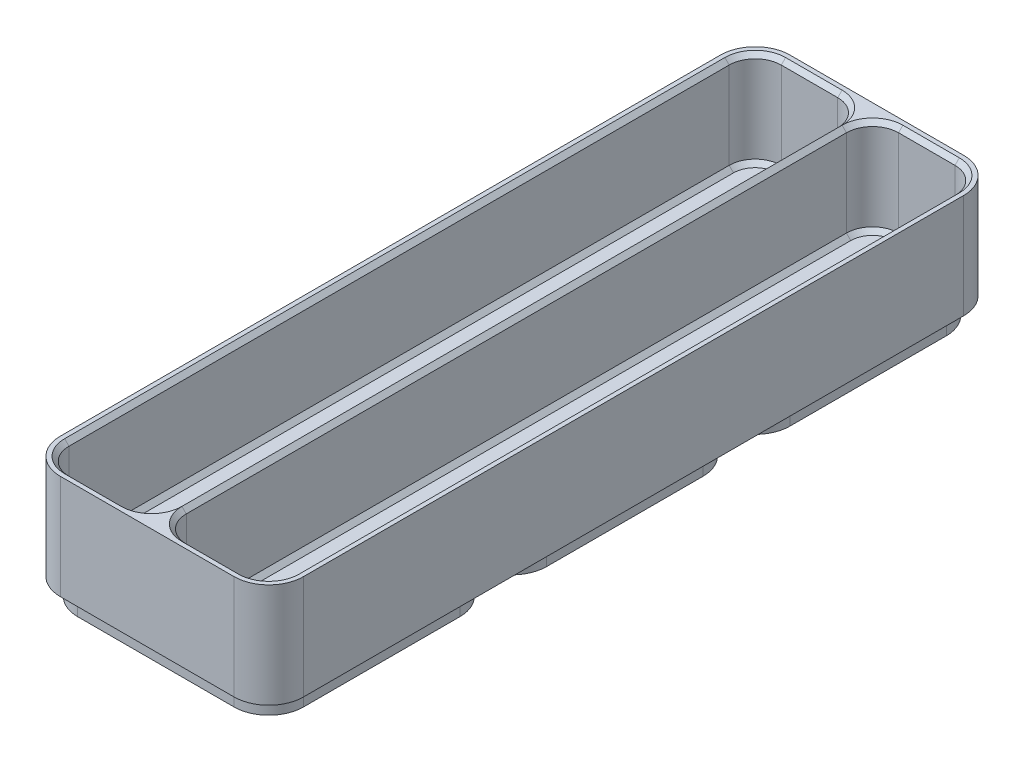
from build123d import *

# Parameters (mm, degrees)
BOSS_EXTRUDE4_DEPTH = 5
SKETCH7_R           = 3
CUT_EXTRUDE4_DEPTH  = 2
SKETCH8_W           = 70
SKETCH8_H           = 70
BOSS_EXTRUDE5_DEPTH = 30
MIRROR2_START       = 5
MIRROR2_OUTLINE_W   = 70
MIRROR2_OUTLINE_H   = 70
MIRROR2_DEPTH       = 30
MIRROR2_2_OUTLINE_R = 3
MIRROR2_2_DEPTH     = 5
MIRROR2_START_2     = 2
MIRROR2_3_OUTLINE_R = 3
MIRROR2_3_DEPTH     = 3
FILLET1_R           = 10
CUT_EXTRUDE5_DEPTH  = 30
BOSS_EXTRUDE6_DEPTH = 2.5
BOSS_EXTRUDE7_DEPTH = 27.5
FILLET2_R           = 7.5
CHAMFER1_SIZE       = 1.25


# Read off the part's stored shape, not the designer's step: Mirror2
with BuildPart() as part:
    # Sketch5 → Boss-Extrude4 (new body)
    with BuildSketch(Plane(origin=(0, 0, 0), x_dir=(1, 0, 0), z_dir=(0, 1, 0))):
        with BuildLine():
            Line((-22.5, -32.5), (22.5, -32.5))
            ThreePointArc((22.5, -32.5), (29.571067812, -29.571067812), (32.5, -22.5))
            Line((32.5, -22.5), (32.5, 22.5))
            ThreePointArc((32.5, 22.5), (29.571067812, 29.571067812), (22.5, 32.5))
            Line((22.5, 32.5), (-22.5, 32.5))
            ThreePointArc((-22.5, 32.5), (-29.571067812, 29.571067812), (-32.5, 22.5))
            Line((-32.5, 22.5), (-32.5, -22.5))
            ThreePointArc((-32.5, -22.5), (-29.571067812, -29.571067812), (-22.5, -32.5))
        make_face()
    extrude(amount=BOSS_EXTRUDE4_DEPTH)

    # Sketch7 → Cut-Extrude4 (cut)
    with BuildSketch(Plane.XZ):
        with Locations(Location((-26.035533906, 26.035533906, 0), (0, 0, 270))):
            Circle(SKETCH7_R)
        with Locations(Location((26.036533906, 26.036533906, 0), (0, 0, 270))):
            Circle(SKETCH7_R)
        with Locations(Location((26.037533906, -26.035533906, 0), (0, 0, 270))):
            Circle(SKETCH7_R)
        with Locations(Location((-26.034533906, -26.036533906, 0), (0, 0, 270))):
            Circle(SKETCH7_R)
    extrude(amount=-CUT_EXTRUDE4_DEPTH, mode=Mode.SUBTRACT)

    # Sketch8 → Boss-Extrude5 (add)
    with BuildSketch(Plane(origin=(0, 5, 0), x_dir=(1, 0, 0), z_dir=(0, 1, 0))):
        Rectangle(SKETCH8_W, SKETCH8_H)
    extrude(amount=BOSS_EXTRUDE5_DEPTH)

    # Mirror2 outline → Mirror2 (add)
    with BuildSketch(Plane(origin=(0, 0, 0), x_dir=(1, 0, 0), z_dir=(0, 1, 0)).offset(MIRROR2_START)):
        with Locations((0, -70)):
            Rectangle(MIRROR2_OUTLINE_W, MIRROR2_OUTLINE_H)
        with Locations((0, 70)):
            Rectangle(MIRROR2_OUTLINE_W, MIRROR2_OUTLINE_H)
    extrude(amount=MIRROR2_DEPTH)

    # Mirror2 2 outline → Mirror2 2 (add)
    # profile 1 of 2: a face of its own
    with BuildSketch(Plane(origin=(0, 0, 0), x_dir=(1, 0, 0), z_dir=(0, 1, 0))):
        with BuildLine():
            Line((32.5, -92.5), (32.5, -47.5))
            ThreePointArc((32.5, -47.5), (29.571067812, -40.428932188), (22.5, -37.5))
            Line((22.5, -37.5), (-22.5, -37.5))
            ThreePointArc((-22.5, -37.5), (-29.571067812, -40.428932188), (-32.5, -47.5))
            Line((-32.5, -47.5), (-32.5, -92.5))
            ThreePointArc((-32.5, -92.5), (-29.571067812, -99.571067812), (-22.5, -102.5))
            Line((-22.5, -102.5), (22.5, -102.5))
            ThreePointArc((22.5, -102.5), (29.571067812, -99.571067812), (32.5, -92.5))
        make_face()
        with Locations((-26.034533906, -96.036533906)):
            Circle(MIRROR2_2_OUTLINE_R, mode=Mode.SUBTRACT)
        with Locations((-26.035533906, -43.964466094)):
            Circle(MIRROR2_2_OUTLINE_R, mode=Mode.SUBTRACT)
        with Locations((26.037533906, -96.035533906)):
            Circle(MIRROR2_2_OUTLINE_R, mode=Mode.SUBTRACT)
        with Locations((26.036533906, -43.963466094)):
            Circle(MIRROR2_2_OUTLINE_R, mode=Mode.SUBTRACT)
    # profile 2 of 2: a face of its own
    with BuildSketch(Plane(origin=(0, 0, 0), x_dir=(1, 0, 0), z_dir=(0, 1, 0))):
        with BuildLine():
            Line((32.5, 47.5), (32.5, 92.5))
            ThreePointArc((32.5, 92.5), (29.571067812, 99.571067812), (22.5, 102.5))
            Line((22.5, 102.5), (-22.5, 102.5))
            ThreePointArc((-22.5, 102.5), (-29.571067812, 99.571067812), (-32.5, 92.5))
            Line((-32.5, 92.5), (-32.5, 47.5))
            ThreePointArc((-32.5, 47.5), (-29.571067812, 40.428932188), (-22.5, 37.5))
            Line((-22.5, 37.5), (22.5, 37.5))
            ThreePointArc((22.5, 37.5), (29.571067812, 40.428932188), (32.5, 47.5))
        make_face()
        with Locations((-26.034533906, 43.963466094)):
            Circle(MIRROR2_2_OUTLINE_R, mode=Mode.SUBTRACT)
        with Locations((-26.035533906, 96.035533906)):
            Circle(MIRROR2_2_OUTLINE_R, mode=Mode.SUBTRACT)
        with Locations((26.037533906, 43.964466094)):
            Circle(MIRROR2_2_OUTLINE_R, mode=Mode.SUBTRACT)
        with Locations((26.036533906, 96.036533906)):
            Circle(MIRROR2_2_OUTLINE_R, mode=Mode.SUBTRACT)
    extrude(amount=MIRROR2_2_DEPTH)

    # Mirror2 3 outline → Mirror2 3 (add)
    with BuildSketch(Plane(origin=(0, 0, 0), x_dir=(1, 0, 0), z_dir=(0, 1, 0)).offset(MIRROR2_START_2)):
        with Locations((-26.035533906, -43.964466094)):
            Circle(MIRROR2_3_OUTLINE_R)
        with Locations((26.036533906, -43.963466094)):
            Circle(MIRROR2_3_OUTLINE_R)
        with Locations((26.037533906, -96.035533906)):
            Circle(MIRROR2_3_OUTLINE_R)
        with Locations((-26.034533906, -96.036533906)):
            Circle(MIRROR2_3_OUTLINE_R)
        with Locations((-26.035533906, 96.035533906)):
            Circle(MIRROR2_3_OUTLINE_R)
        with Locations((26.036533906, 96.036533906)):
            Circle(MIRROR2_3_OUTLINE_R)
        with Locations((26.037533906, 43.964466094)):
            Circle(MIRROR2_3_OUTLINE_R)
        with Locations((-26.034533906, 43.963466094)):
            Circle(MIRROR2_3_OUTLINE_R)
    extrude(amount=MIRROR2_3_DEPTH)

    # Fillet1
    fillet1_edges = [part.edges().sort_by_distance(p)[0] for p in [
        (35, 20, 105),
        (-35, 20, 105),
        (-35, 20, -105),
        (35, 20, -105),
    ]]
    fillet(fillet1_edges, radius=FILLET1_R)

    # Sketch9 → Cut-Extrude5 (cut)
    with BuildSketch(Plane(origin=(0, 35, 0), x_dir=(1, 0, 0), z_dir=(0, 1, 0))):
        with BuildLine():
            Line((-32.5, 95), (-32.5, -95))
            ThreePointArc((-32.5, -95), (-30.303300859, -100.303300859), (-25, -102.5))
            Line((-25, -102.5), (25, -102.5))
            ThreePointArc((25, -102.5), (30.303300859, -100.303300859), (32.5, -95))
            Line((32.5, -95), (32.5, 95))
            ThreePointArc((32.5, 95), (30.303300859, 100.303300859), (25, 102.5))
            Line((25, 102.5), (-25, 102.5))
            ThreePointArc((-25, 102.5), (-30.303300859, 100.303300859), (-32.5, 95))
        make_face()
    extrude(amount=-CUT_EXTRUDE5_DEPTH, mode=Mode.SUBTRACT)


with BuildPart() as cut_extrude5_piece_1:
    # of the separate pieces the step leaves, piece 1, a body of its own (cut_extrude5_pieces)
    add(part.part.solids().sort_by_distance((35, 5, 95))[0])



with BuildPart() as cut_extrude5_piece_2:
    # of the separate pieces the step leaves, piece 2, a body of its own (cut_extrude5_pieces)
    add(part.part.solids().sort_by_distance((32.5, 0, 92.5))[0])


with BuildPart() as cut_extrude5_piece_3:
    # of the separate pieces the step leaves, piece 3, a body of its own (cut_extrude5_pieces)
    add(part.part.solids().sort_by_distance((32.5, 0, -47.5))[0])


with BuildPart() as cut_extrude5_piece_4:
    # of the separate pieces the step leaves, piece 4, a body of its own (cut_extrude5_pieces)
    add(part.part.solids().sort_by_distance((32.5, 0, 22.5))[0])


with BuildPart() as cut_extrude5_piece_1_1:
    add(cut_extrude5_piece_1.part)

    add(cut_extrude5_piece_2.part)  # Boss-Extrude6 merges Cut-Extrude5 piece 2

    add(cut_extrude5_piece_3.part)  # Boss-Extrude6 merges Cut-Extrude5 piece 3

    add(cut_extrude5_piece_4.part)  # Boss-Extrude6 merges Cut-Extrude5 piece 4
    # Sketch10 → Boss-Extrude6 (add)
    with BuildSketch(Plane.XZ.offset(-5)):
        with BuildLine():
            Line((25, 105), (-25, 105))
            ThreePointArc((-25, 105), (-32.071067812, 102.071067812), (-35, 95))
            Line((-35, 95), (-35, -95))
            ThreePointArc((-35, -95), (-32.071067812, -102.071067812), (-25, -105))
            Line((-25, -105), (25, -105))
            ThreePointArc((25, -105), (32.071067812, -102.071067812), (35, -95))
            Line((35, -95), (35, 95))
            ThreePointArc((35, 95), (32.071067812, 102.071067812), (25, 105))
        make_face()
    extrude(amount=-BOSS_EXTRUDE6_DEPTH)

    # Sketch11 → Boss-Extrude7 (add)
    with BuildSketch(Plane(origin=(0, 35, 0), x_dir=(1, 0, 0), z_dir=(0, 1, 0))):
        Polygon((-1.25, -102.5), (1.25, -102.5), (1.25, 102.5), (0, 102.5), (-1.25, 102.5), align=None)
    extrude(amount=-BOSS_EXTRUDE7_DEPTH)

    # Fillet2
    fillet2_edges = [cut_extrude5_piece_1_1.edges().sort_by_distance(p)[0] for p in [
        (-1.25, 21.25, 102.5),
        (1.25, 21.25, 102.5),
        (1.25, 21.25, -102.5),
        (-1.25, 21.25, -102.5),
    ]]
    fillet(fillet2_edges, radius=FILLET2_R)

    # Chamfer1
    chamfer1_edges = [cut_extrude5_piece_1_1.edges().sort_by_distance(p)[0] for p in [
        (-16.875, 35, 102.5),
        (-32.5, 35, 0),
        (-30.303300859, 35, 100.303300859),
        (30.303300859, 35, 100.303300859),
        (30.303300859, 35, -100.303300859),
        (-30.303300859, 35, -100.303300859),
        (1.25, 7.5, 0),
        (1.25, 35, 0),
        (16.875, 7.5, 102.5),
        (3.446699141, 7.5, 100.303300859),
        (3.446699141, 7.5, -100.303300859),
        (16.875, 35, 102.5),
        (-1.25, 7.5, 0),
        (-1.25, 35, 0),
        (-16.875, 7.5, -102.5),
        (-3.446699141, 7.5, -100.303300859),
        (-3.446699141, 7.5, 100.303300859),
        (-16.875, 35, -102.5),
        (3.446699141, 35, -100.303300859),
        (3.446699141, 35, 100.303300859),
        (-3.446699141, 35, 100.303300859),
        (-3.446699141, 35, -100.303300859),
        (-30.303300859, 7.5, -100.303300859),
        (-16.875, 7.5, 102.5),
        (30.303300859, 7.5, 100.303300859),
        (32.5, 7.5, 0),
        (30.303300859, 7.5, -100.303300859),
        (16.875, 7.5, -102.5),
        (-32.5, 7.5, 0),
        (-30.303300859, 7.5, 100.303300859),
        (16.875, 35, -102.5),
        (32.5, 35, 0),
    ]]
    chamfer(chamfer1_edges, length=CHAMFER1_SIZE - 0.0001)  # a hair under: the kernel refuses the full size


solid = cut_extrude5_piece_1_1.part
